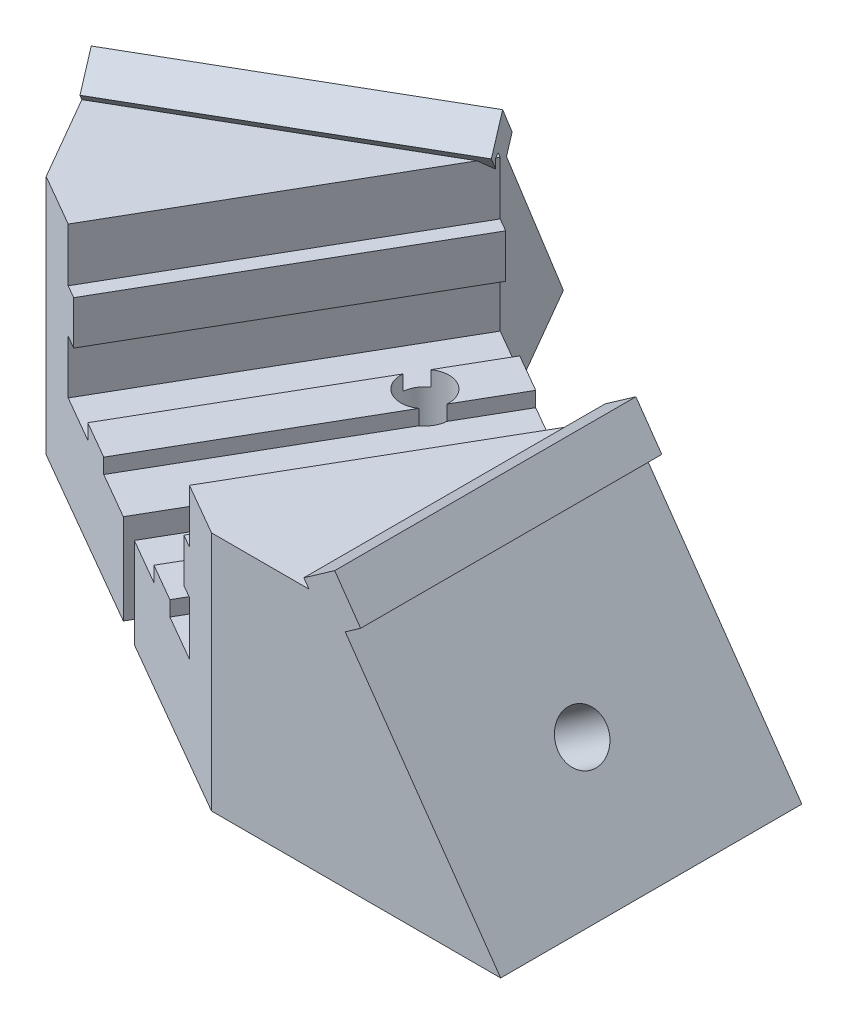
from build123d import *

# Parameters (mm, degrees)
MAIN_DEPTH                     = 20
ESQUISSE2_R                    = 1.6
HOLEFORLAUNCHERFIXING_DEPTH    = 26.44497439
ESQUISSE4_W                    = 22.287049145
ESQUISSE4_H                    = 34.815979295
ENL_V_MAT_EXTRU_3_DEPTH        = 6
MAKERBEANFIXING_DEPTH          = 21
ESQUISSE6_W                    = 20
ESQUISSE6_H                    = 3
ANTIROTATIONSYSTEM_DEPTH       = 1.25
ESQUISSE7_R                    = 1.6
TOPMAKERBEANFIXINGHOLE_DEPTH   = 30.799255922
ENL_V_MAT_EXTRU_4_DEPTH        = 34.013087438
ESQUISSE3_R                    = 4.25
BIGHOLEFORLAUNCHERFIXING_DEPTH = 32.237900593


with BuildPart() as part:
    # Esquisse1 → Main (new body)
    with BuildSketch(Plane.XY):
        Polygon((8, 16), (19.203320611, 0), (0, 0), (0, 16), align=None)
    extrude(amount=MAIN_DEPTH)

    # Esquisse2 → HoleForLauncherFixing (cut, through all)
    with BuildSketch(Plane(origin=(12.88562154, 9.022609337, 0), x_dir=(0, 0, -1), z_dir=(0.8191520442889929, 0.5735764363510446, 0))):
        with Locations((-10, -3.014572202)):
            Circle(ESQUISSE2_R)
    extrude(amount=-HOLEFORLAUNCHERFIXING_DEPTH, mode=Mode.SUBTRACT)

    # Esquisse4 → Enlèv. mat.-Extru.3 (cut)
    with BuildSketch(Plane(origin=(0, 0, 0), x_dir=(0, -1, 0), z_dir=(-0.8660254037844398, 0, -0.499999999999998))):
        with Locations((-6.644134867, 0.407683814)):
            Rectangle(ESQUISSE4_W, ESQUISSE4_H)
    extrude(amount=-ENL_V_MAT_EXTRU_3_DEPTH, mode=Mode.SUBTRACT)

    # Esquisse5 → MakerBeanFixing (add)
    with BuildSketch(Plane(origin=(-3.464101615, 0, 18), x_dir=(-0.8660254037844398, 0, -0.49999999999999806), z_dir=(0.499999999999998, 0, -0.8660254037844397))):
        Polygon((-4, 0), (10, 0), (10, 6), (6.45, 6), (6.45, 7), (3.55, 7), (3.55, 6), (0, 6), (0, 9.55), (1, 9.55), (1, 12.45), (0, 12.45), (0, 16), (-4, 16), align=None)
    extrude(amount=MAKERBEANFIXING_DEPTH)

    # Esquisse6 → AntiRotationSystem (add, symmetric)
    with BuildSketch(Plane(origin=(12.88562154, 9.022609337, 0), x_dir=(0, 0, -1), z_dir=(0.819152044288993, 0.5735764363510446, 0))):
        with Locations((-10, 8.485427798)):
            Rectangle(ESQUISSE6_W, ESQUISSE6_H)
    extrude(amount=ANTIROTATIONSYSTEM_DEPTH, both=True)

    # Esquisse7 → TopMakerBeanFixingHole (cut, through all)
    with BuildSketch(Plane(origin=(0, 7, 0), x_dir=(1, 0, 0), z_dir=(0, 1, 0))):
        with Locations((0.205771366, -1.643593539)):
            Circle(ESQUISSE7_R)
    extrude(amount=-TOPMAKERBEANFIXINGHOLE_DEPTH, mode=Mode.SUBTRACT)

    # Esquisse8 → Enlèv. mat.-Extru.4 (cut, through all)
    with BuildSketch(Plane(origin=(0, 0, 0), x_dir=(-1, 0, 0), z_dir=(0, 0, -1))):
        Polygon((-8.878944757, 14.744736797), (-19.203320611, 0), (-22.6847168, 2.437699854), (-10.639611636, 19.639892785), (-8.182155503, 17.919163476), (-9.902884812, 15.461707343), align=None)
    extrude(amount=-ENL_V_MAT_EXTRU_4_DEPTH, mode=Mode.SUBTRACT)

    # Esquisse3 → BigHoleForLauncherFixing (cut, through all)
    with BuildSketch(Plane(origin=(8.789861318, 6.154727155, 0), x_dir=(0, 0, -1), z_dir=(0.8191520442889929, 0.5735764363510446, 0))):
        with Locations((-10, -3.014572202)):
            Circle(ESQUISSE3_R)
    extrude(amount=-BIGHOLEFORLAUNCHERFIXING_DEPTH, mode=Mode.SUBTRACT)


with BuildPart() as body_2:
    # Mirror1: mirrored copy
    add(part.part.mirror(Plane(origin=(-4.330127019, 0, -2.5), x_dir=(-0.499999999999998, 0, 0.8660254037844398), z_dir=(-0.8660254037844398, 0, -0.499999999999998))))


solid = Compound([part.part, body_2.part])
